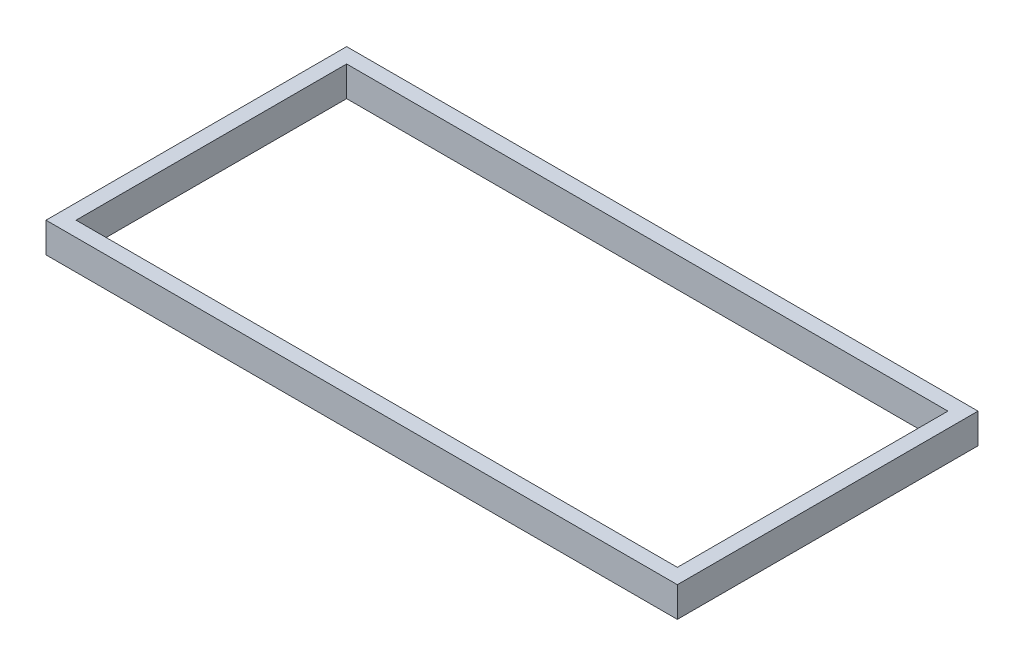
from build123d import *

# Parameters (mm, degrees)
SKETCH1_W           = 2100
SKETCH1_H           = 1000
BOSS_EXTRUDE1_DEPTH = 50
CUT_EXTRUDE1_REACH  = 1169.262
SKETCH2_W           = 2000
SKETCH2_H           = 900


with BuildPart() as part:
    # Sketch1 → Boss-Extrude1 (new, symmetric)
    with BuildSketch(Plane(origin=(0, 0, 0), x_dir=(1, 0, 0), z_dir=(0, 1, 0))):
        Rectangle(SKETCH1_W, SKETCH1_H)
    extrude(amount=BOSS_EXTRUDE1_DEPTH, both=True)

    # Sketch2 → Cut-Extrude1 (cut, up to next)
    with BuildSketch(Plane(origin=(0, 50, 0), x_dir=(1, 0, 0), z_dir=(0, 1, 0)), mode=Mode.PRIVATE) as cut_extrude1_sk1:
        Rectangle(SKETCH2_W, SKETCH2_H)
    cut_extrude1_tool1 = extrude(cut_extrude1_sk1.sketch, amount=-CUT_EXTRUDE1_REACH, mode=Mode.PRIVATE) & part.part
    add(cut_extrude1_tool1.solids().sort_by_distance((0, 50, 0))[0], mode=Mode.SUBTRACT)


solid = part.part
